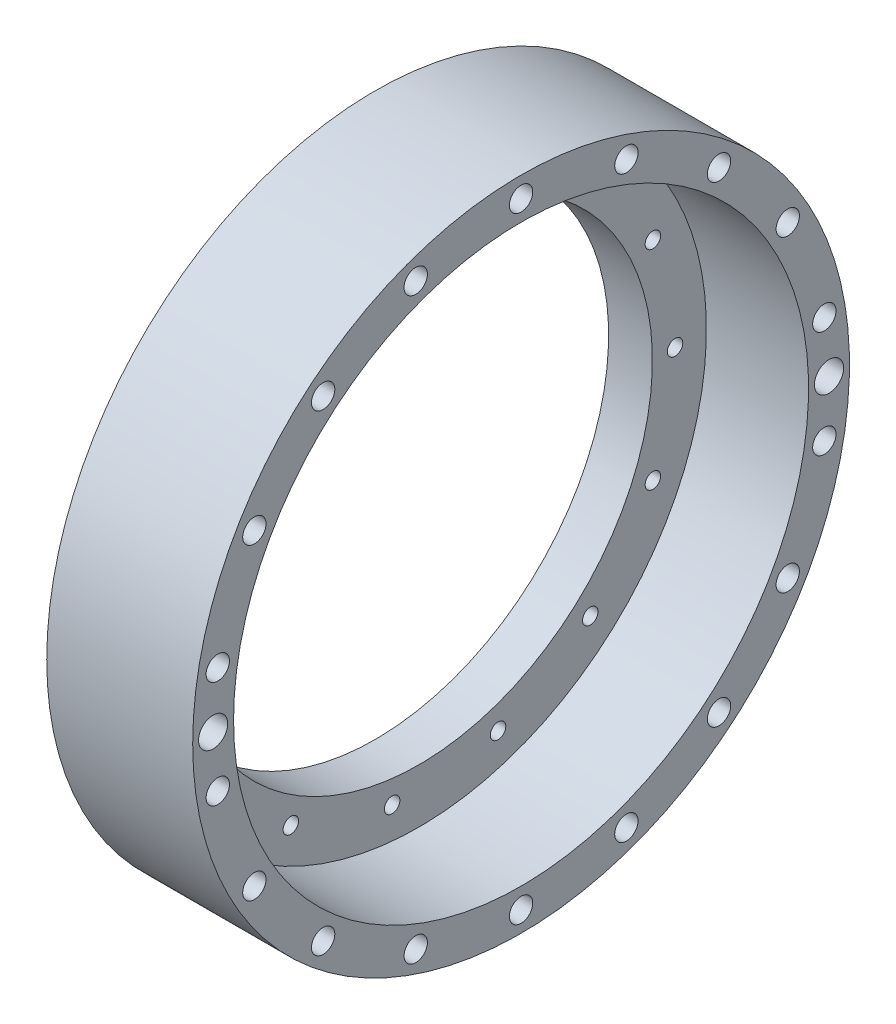
from build123d import *

# Parameters (mm, degrees)
SKETCH3_R             = 5
CUT_EXTRUDE1_DEPTH    = 167.770800802
F_8_0MM_DOWEL_HOLE1_D = 8
CIRPATTERN1_COUNT     = 18
SKETCH7_R             = 2.65
CUT_EXTRUDE2_DEPTH    = 163.903345576
CIRPATTERN2_COUNT     = 15


with BuildPart() as part:
    # Sketch1 → Revolve1 (revolve)
    with BuildSketch(Plane.XY):
        Polygon((0, 112.5), (0, 80), (15, 80), (15, 98.5), (50, 98.5), (50, 112.5), align=None)
    revolve(axis=Axis((0, 0, 0), (1, 0, 0)))

    # Sketch3 → Cut-Extrude1 (cut, through all)
    with BuildSketch(Plane(origin=(50, 0, 0), x_dir=(0, 0, -1), z_dir=(1, 0, 0))):
        with Locations((105.5, 0)):
            Circle(SKETCH3_R)
        with Locations((-105.5, 0)):
            Circle(SKETCH3_R)
    extrude(amount=-CUT_EXTRUDE1_DEPTH, mode=Mode.SUBTRACT)

    # Ø8.0mm Dowel Hole1 (through all)
    with Locations(Plane(origin=(50, 105.5, 0), x_dir=(0, 0, 1), z_dir=(1, 0, 0))):
        with Locations((0, 0)):
            f_8_0mm_dowel_hole1 = Hole(F_8_0MM_DOWEL_HOLE1_D / 2)

    # CirPattern1: Ø8.0mm Dowel Hole1 ×18 about axis
    cirpattern1_axis = Axis((50, 0, 0), (-1, 0, 0))
    for i in range(1, CIRPATTERN1_COUNT):
        add(f_8_0mm_dowel_hole1.rotate(cirpattern1_axis, i * 360 / CIRPATTERN1_COUNT), mode=Mode.SUBTRACT)

    # Sketch7 → Cut-Extrude2 (cut, through all)
    with BuildSketch(Plane(origin=(15, 0, 0), x_dir=(0, 0, -1), z_dir=(1, 0, 0))):
        with Locations((87.75, 0)):
            Circle(SKETCH7_R)
    cut_extrude2 = extrude(amount=-CUT_EXTRUDE2_DEPTH, mode=Mode.SUBTRACT)

    # CirPattern2: Cut-Extrude2 ×15 about axis
    cirpattern2_axis = Axis((50, 0, 0), (-1, 0, 0))
    for i in range(1, CIRPATTERN2_COUNT):
        add(cut_extrude2.rotate(cirpattern2_axis, i * 360 / CIRPATTERN2_COUNT), mode=Mode.SUBTRACT)


solid = part.part
